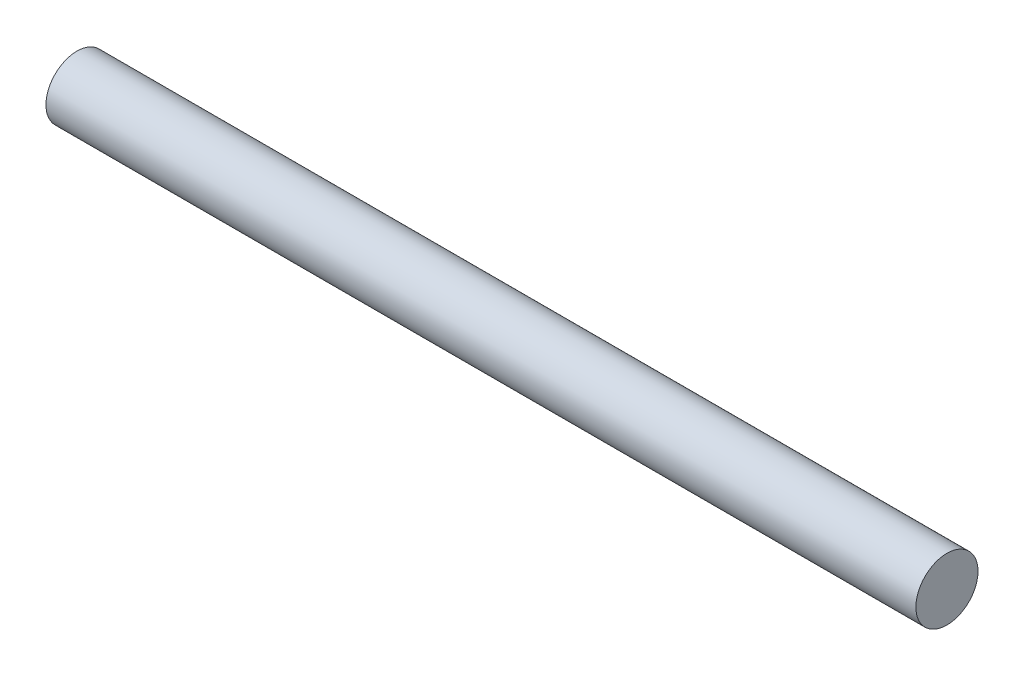
from build123d import *

# Parameters (mm, degrees)
SKETCH1_R           = 5
BOSS_EXTRUDE1_DEPTH = 140


with BuildPart() as part:
    # Sketch1 → Boss-Extrude1 (new body)
    with BuildSketch(Plane(origin=(0, 0, 0), x_dir=(0, 0, -1), z_dir=(1, 0, 0))):
        Circle(SKETCH1_R)
    extrude(amount=BOSS_EXTRUDE1_DEPTH)


solid = part.part
